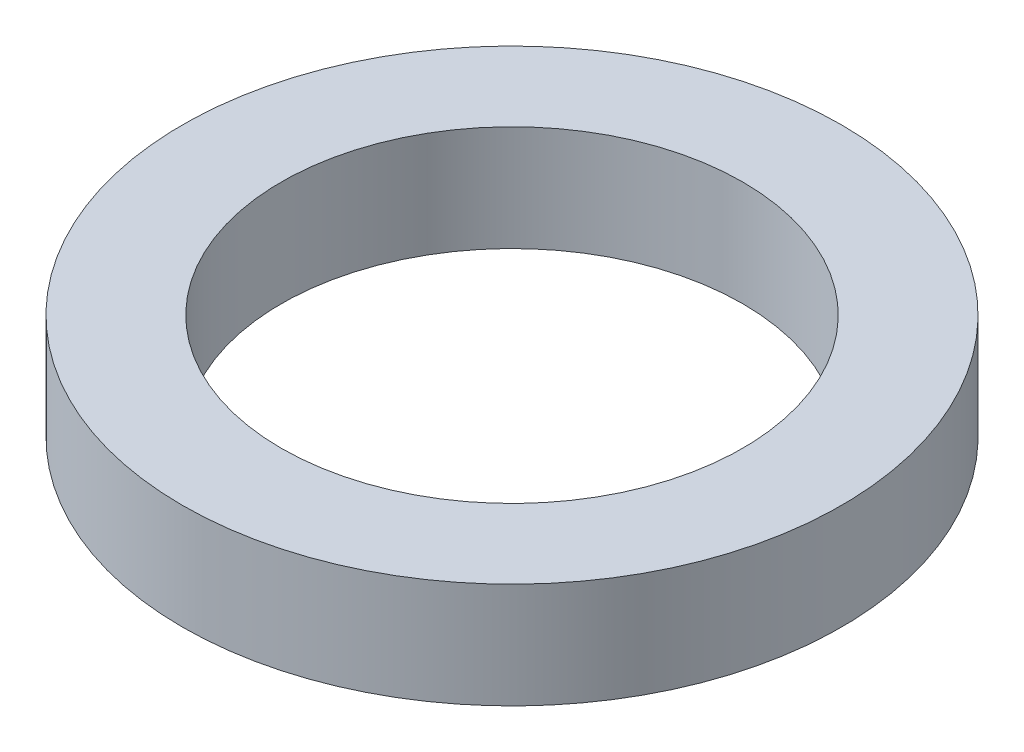
from build123d import *

# Parameters (mm, degrees)
SKETCH1_R           = 25
BOSS_EXTRUDE1_DEPTH = 8
SKETCH2_R           = 17.5
CUT_EXTRUDE1_DEPTH  = 37.249137921


with BuildPart() as part:
    # Sketch1 → Boss-Extrude1 (new body)
    with BuildSketch(Plane(origin=(0, 0, 0), x_dir=(1, 0, 0), z_dir=(0, 1, 0))):
        Circle(SKETCH1_R)
    extrude(amount=BOSS_EXTRUDE1_DEPTH)

    # Sketch2 → Cut-Extrude1 (cut, through all)
    with BuildSketch(Plane(origin=(0, 0, 0), x_dir=(1, 0, 0), z_dir=(0, 1, 0))):
        Circle(SKETCH2_R)
    extrude(amount=CUT_EXTRUDE1_DEPTH, mode=Mode.SUBTRACT)


solid = part.part
